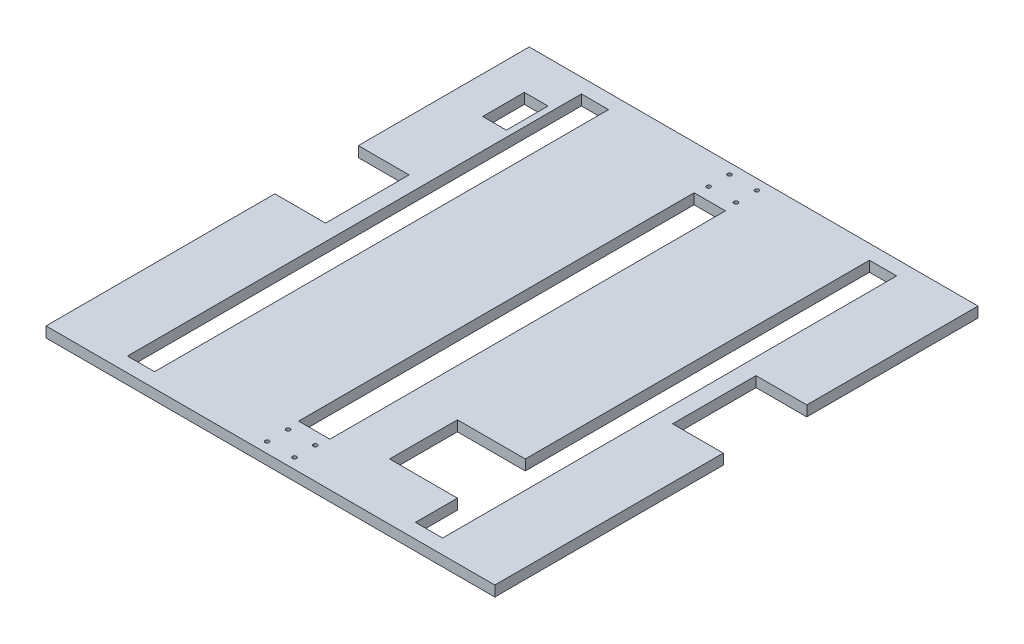
from build123d import *

# Parameters (mm, degrees)
SKETCH1_W           = 430
SKETCH1_H           = 463
BOSS_EXTRUDE1_DEPTH = 10
SKETCH2_W           = 48.6
SKETCH2_H           = 80
CUT_EXTRUDE1_DEPTH  = 10
SKETCH3_R           = 1.9
SKETCH3_W           = 26
SKETCH3_H           = 435
SKETCH3_W_2         = 22.64710068
SKETCH3_H_2         = 40
SKETCH3_W_3         = 30
SKETCH3_H_3         = 379
CUT_EXTRUDE2_DEPTH  = 10
SKETCH4_W           = 65
SKETCH4_H           = 65
CUT_EXTRUDE3_DEPTH  = 10


with BuildPart() as part:
    # Sketch1 → Boss-Extrude1 (new body)
    with BuildSketch(Plane(origin=(0, 0, 0), x_dir=(1, 0, 0), z_dir=(0, 1, 0))):
        with Locations((6126.084066999, -8720.812377786)):
            Rectangle(SKETCH1_W, SKETCH1_H)
    extrude(amount=BOSS_EXTRUDE1_DEPTH)

    # Sketch2 → Cut-Extrude1 (cut)
    with BuildSketch(Plane(origin=(0, 10, 0), x_dir=(1, 0, 0), z_dir=(0, 1, 0))):
        with Locations((5935.384066999, -8693.059787309)):
            Rectangle(SKETCH2_W, SKETCH2_H)
        with Locations((6316.784066999, -8693.384418705)):
            Rectangle(SKETCH2_W, SKETCH2_H)
    extrude(amount=-CUT_EXTRUDE1_DEPTH, mode=Mode.SUBTRACT)

    # Sketch3 → Cut-Extrude2 (cut)
    with BuildSketch(Plane(origin=(0, 10, 0), x_dir=(1, 0, 0), z_dir=(0, 1, 0))):
        with Locations((6112.984066999, -8942.312377786)):
            Circle(SKETCH3_R)
        with Locations((6139.184066999, -8942.312377786)):
            Circle(SKETCH3_R)
        with Locations((6112.984066999, -8499.312377786)):
            Circle(SKETCH3_R)
        with Locations((6139.184066999, -8499.312377786)):
            Circle(SKETCH3_R)
        with Locations((6112.984066999, -8922.312377786)):
            Circle(SKETCH3_R)
        with Locations((6139.184066999, -8922.312377786)):
            Circle(SKETCH3_R)
        with Locations((6112.984066999, -8519.312377786)):
            Circle(SKETCH3_R)
        with Locations((6139.184066999, -8519.312377786)):
            Circle(SKETCH3_R)
        Polygon((5975.084066999, -8541.651929061), (5975.084066999, -8938.312377786), (6001.084066999, -8938.312377786), (6001.084066999, -8503.312377786), (5975.084066999, -8503.312377786), align=None)
        with Locations((6264.084066999, -8720.812377786)):
            Rectangle(SKETCH3_W, SKETCH3_H)
        with Locations((5957.807617339, -8549.312377786)):
            Rectangle(SKETCH3_W_2, SKETCH3_H_2)
        with Locations((6126.084066999, -8720.812377786)):
            Rectangle(SKETCH3_W_3, SKETCH3_H_3)
    extrude(amount=-CUT_EXTRUDE2_DEPTH, mode=Mode.SUBTRACT)

    # Sketch4 → Cut-Extrude3 (cut)
    with BuildSketch(Plane(origin=(0, 10, 0), x_dir=(1, 0, 0), z_dir=(0, 1, 0))):
        with Locations((6218.584066999, -8865.596518708)):
            Rectangle(SKETCH4_W, SKETCH4_H)
    extrude(amount=-CUT_EXTRUDE3_DEPTH, mode=Mode.SUBTRACT)


solid = part.part
